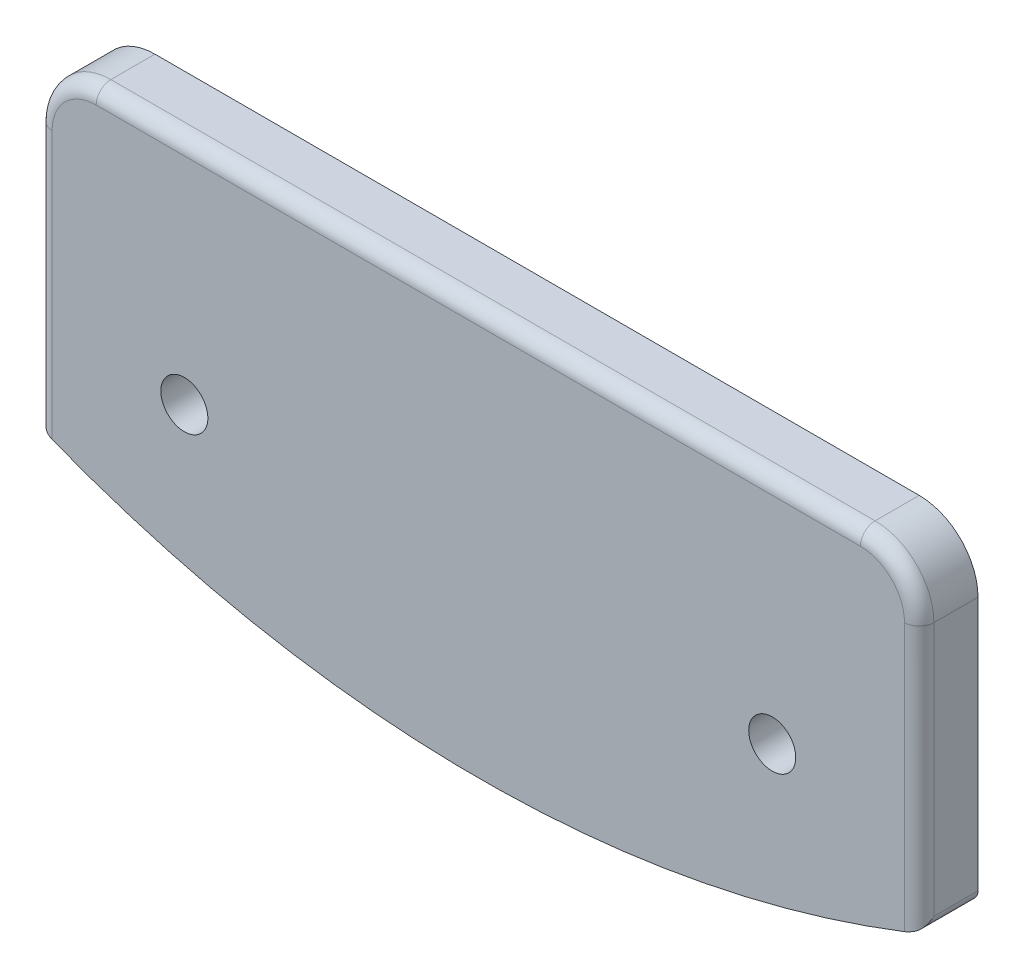
from build123d import *

# Parameters (mm, degrees)
SKETCH_1_R      = 1.6
EXTRUDE_1_DEPTH = 2.5
EXTRUDE_START   = 2.5
SKETCH_1_2_R    = 1.6
EXTRUDE_2_DEPTH = 1.5
FILLET_1_R      = 1
FILLET_2_R      = 1
FILLET_3_R      = 0.75


with BuildPart() as part:
    # Эскиз1 → Бобышка-Вытянуть1 (new body)
    with BuildSketch(Plane.XY):
        with BuildLine():
            Line((-26.000019619, -52.3500154), (26.000019619, -52.3500154))
            ThreePointArc((26.000019619, -52.3500154), (28.828446744, -53.521588275), (30.000019619, -56.3500154))
            Line((30.000019619, -56.3500154), (30.000019619, -74.161976935))
            ThreePointArc((30.000019619, -74.161976935), (0, -80), (-30.000019619, -74.161976935))
            Line((-30.000019619, -74.161976935), (-30.000019619, -56.3500154))
            ThreePointArc((-30.000019619, -56.3500154), (-28.828446744, -53.521588275), (-26.000019619, -52.3500154))
        make_face()
        with Locations((-20, -68)):
            Circle(SKETCH_1_R, mode=Mode.SUBTRACT)
        with Locations(Location((20, -68, 0), (0, 0, 180))):
            Circle(SKETCH_1_R, mode=Mode.SUBTRACT)
        with BuildLine():
            Line((-26.000019619, -53.3500154), (2.649996038, -53.3500154))
            ThreePointArc((2.649996038, -53.3500154), (4.771316381, -54.228695057), (5.649996038, -56.3500154))
            Line((5.649996038, -56.3500154), (5.649996038, -63.999979818))
            Line((5.649996038, -63.999979818), (-29.000019619, -63.999979818))
            Line((-29.000019619, -63.999979818), (-29.000019619, -56.3500154))
            ThreePointArc((-29.000019619, -56.3500154), (-28.121339962, -54.228695057), (-26.000019619, -53.3500154))
        make_face(mode=Mode.SUBTRACT)
    extrude(amount=EXTRUDE_1_DEPTH)

    # Эскиз1<2> → Бобышка-Вытянуть2 (add)
    with BuildSketch(Plane.XY.offset(EXTRUDE_START)):
        with BuildLine():
            Line((-26.000019619, -52.3500154), (26.000019619, -52.3500154))
            ThreePointArc((26.000019619, -52.3500154), (28.828446744, -53.521588275), (30.000019619, -56.3500154))
            Line((30.000019619, -56.3500154), (30.000019619, -74.161976935))
            ThreePointArc((30.000019619, -74.161976935), (0, -80), (-30.000019619, -74.161976935))
            Line((-30.000019619, -74.161976935), (-30.000019619, -56.3500154))
            ThreePointArc((-30.000019619, -56.3500154), (-28.828446744, -53.521588275), (-26.000019619, -52.3500154))
        make_face()
        with Locations((-20, -68)):
            Circle(SKETCH_1_2_R, mode=Mode.SUBTRACT)
        with Locations(Location((20, -68, 0), (0, 0, 180))):
            Circle(SKETCH_1_2_R, mode=Mode.SUBTRACT)
    extrude(amount=EXTRUDE_2_DEPTH)

    # Скругление1
    fillet_1_edges = [part.edges().sort_by_distance(p)[0] for p in [
        (5.649996038, -63.999979818, 1.25),
        (-29.000019619, -63.999979818, 1.25),
    ]]
    fillet(fillet_1_edges, radius=FILLET_1_R)

    # Скругление2
    fillet_2_edges = [part.edges().sort_by_distance(p)[0] for p in [
        (30.000019619, -65.255996167, 4),
        (28.828446744, -53.521588275, 4),
        (0, -52.3500154, 4),
        (-28.828446744, -53.521588275, 4),
        (-30.000019619, -65.255996167, 4),
    ]]
    fillet(fillet_2_edges, radius=FILLET_2_R)

    # Скругление3
    # the kernel refuses this fillet: 0.75 mm, written as the material it takes off along each edge
    with BuildSketch(Plane(origin=(-30.000019619, -74.161976935, -1.274451591), x_dir=(0, 1, 0), z_dir=(0, 0, 1))) as fillet_3_piece_1:
        with BuildLine():
            CenterArc((0.507385413, -0.75), FILLET_3_R, 90, 68.34077611)
            ThreePointArc((-0.189661195, -0.473185934), (-0.095207506, -0.236441895), (0, 0))
            Line((0, 0), (0.507385413, 0))
        make_face()
    extrude(amount=5.548903182, mode=Mode.SUBTRACT)
    with BuildSketch(Plane(origin=(30.000019619, -74.161976935, -1.274451591), x_dir=(-0.9282148055127167, -0.3720447215416308, 0), z_dir=(0, 0, 1))) as fillet_3_piece_2:
        with BuildLine():
            CenterArc((0.50739104, -0.749996193), FILLET_3_R, 89.817447948, 68.34077611)
            Line((-0.188770065, -0.470962652), (0, 0))
            ThreePointArc((0, 0), (0.254890318, 0.000406058), (0.509780636, 0))
        make_face()
    extrude(amount=5.548903182, mode=Mode.SUBTRACT)


solid = part.part
